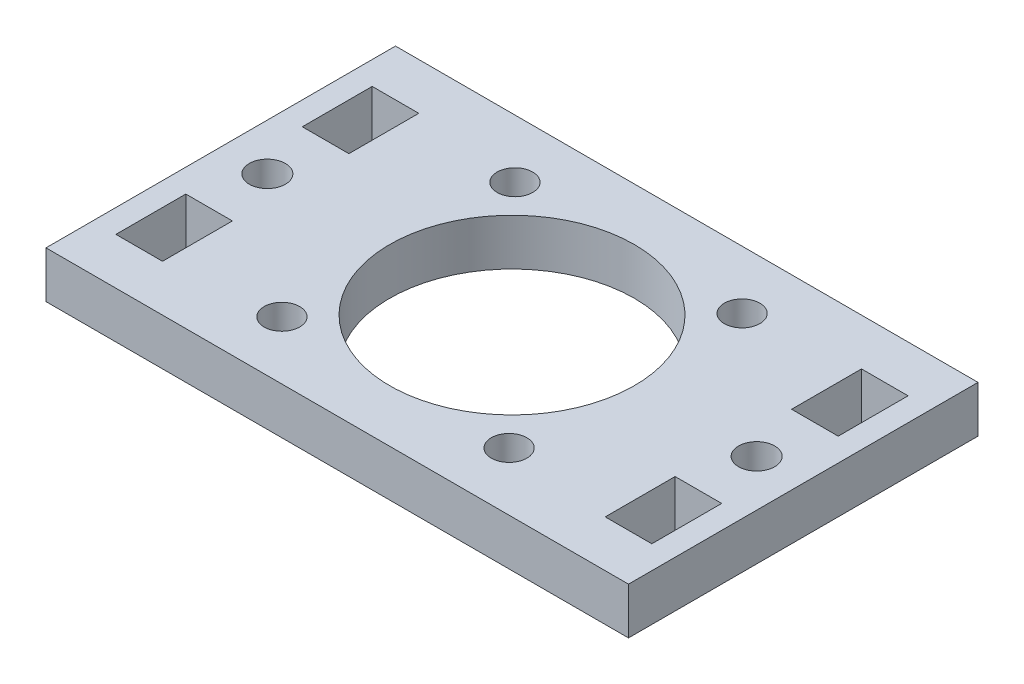
from build123d import *

# Parameters (mm, degrees)
CROQUIS1_W              = 50
CROQUIS1_H              = 30
SALIENTE_EXTRUIR1_DEPTH = 4
CROQUIS2_W              = 4
CROQUIS2_H              = 6
CORTAR_EXTRUIR1_DEPTH   = 30.427877939
CROQUIS3_R              = 1.55
CORTAR_EXTRUIR2_DEPTH   = 30.427877939
CROQUIS4_R              = 10.5
CROQUIS4_R_2            = 1.525
CORTAR_EXTRUIR3_DEPTH   = 30.427877939


with BuildPart() as part:
    # Croquis1 → Saliente-Extruir1 (new body)
    with BuildSketch(Plane(origin=(0, 0, 0), x_dir=(1, 0, 0), z_dir=(0, 1, 0))):
        Rectangle(CROQUIS1_W, CROQUIS1_H)
    extrude(amount=SALIENTE_EXTRUIR1_DEPTH)

    # Croquis2 → Cortar-Extruir1 (cut, through all)
    with BuildSketch(Plane(origin=(0, 4, 0), x_dir=(1, 0, 0), z_dir=(0, 1, 0))):
        with Locations((-21, 8)):
            Rectangle(CROQUIS2_W, CROQUIS2_H)
        with Locations((-21, -8)):
            Rectangle(CROQUIS2_W, CROQUIS2_H)
        with Locations((21, -8)):
            Rectangle(CROQUIS2_W, CROQUIS2_H)
        with Locations((21, 8)):
            Rectangle(CROQUIS2_W, CROQUIS2_H)
    extrude(amount=-CORTAR_EXTRUIR1_DEPTH, mode=Mode.SUBTRACT)

    # Croquis3 → Cortar-Extruir2 (cut, through all)
    with BuildSketch(Plane(origin=(0, 4, 0), x_dir=(1, 0, 0), z_dir=(0, 1, 0))):
        with Locations((-21, 0)):
            Circle(CROQUIS3_R)
        with Locations((21, 0)):
            Circle(CROQUIS3_R)
    extrude(amount=-CORTAR_EXTRUIR2_DEPTH, mode=Mode.SUBTRACT)

    # Croquis4 → Cortar-Extruir3 (cut, through all)
    with BuildSketch(Plane.XZ):
        Circle(CROQUIS4_R)
        with Locations((-9.75, 10)):
            Circle(CROQUIS4_R_2)
        with Locations((-9.75, -10)):
            Circle(CROQUIS4_R_2)
        with Locations((9.75, -10)):
            Circle(CROQUIS4_R_2)
        with Locations((9.75, 10)):
            Circle(CROQUIS4_R_2)
    extrude(amount=-CORTAR_EXTRUIR3_DEPTH, mode=Mode.SUBTRACT)


solid = part.part
